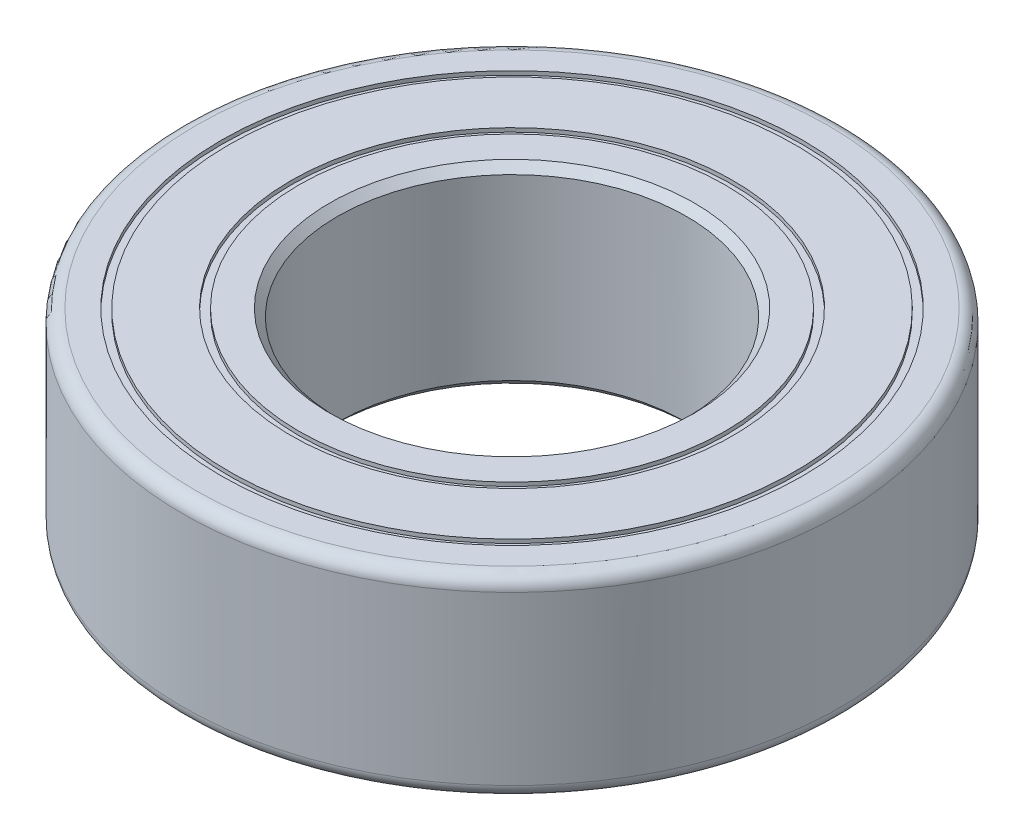
from build123d import *

# Parameters (mm, degrees)
FILLET2_R     = 0.344
CHAMFER2_SIZE = 0.2


with BuildPart() as part:
    # Sketch1 → Revolve1 (revolve)
    with BuildSketch(Plane.XY):
        Polygon((8.5, 0), (8.5, 5), (7.5, 5), (7.5, 4.9), (7.3, 4.9), (7.3, 5), (5.7, 5), (5.7, 4.9), (5.5, 4.9), (5.5, 5), (4.5, 5), (4.5, 0), (5.5, 0), (5.5, 0.1), (5.7, 0.1), (5.7, 0), (7.3, 0), (7.3, 0.1), (7.5, 0.1), (7.5, 0), align=None)
    revolve(axis=Axis((0, 2.5, 0), (0, -1, 0)))

    # Fillet2
    fillet2_edges = [part.edges().sort_by_distance(p)[0] for p in [
        (-8.5, 0, 0),
        (-8.5, 5, 0),
    ]]
    fillet(fillet2_edges, radius=FILLET2_R)

    # Chamfer2
    chamfer2_edges = [part.edges().sort_by_distance(p)[0] for p in [
        (-4.5, 0, 0),
        (-4.5, 5, 0),
    ]]
    chamfer(chamfer2_edges, length=CHAMFER2_SIZE)


solid = part.part
